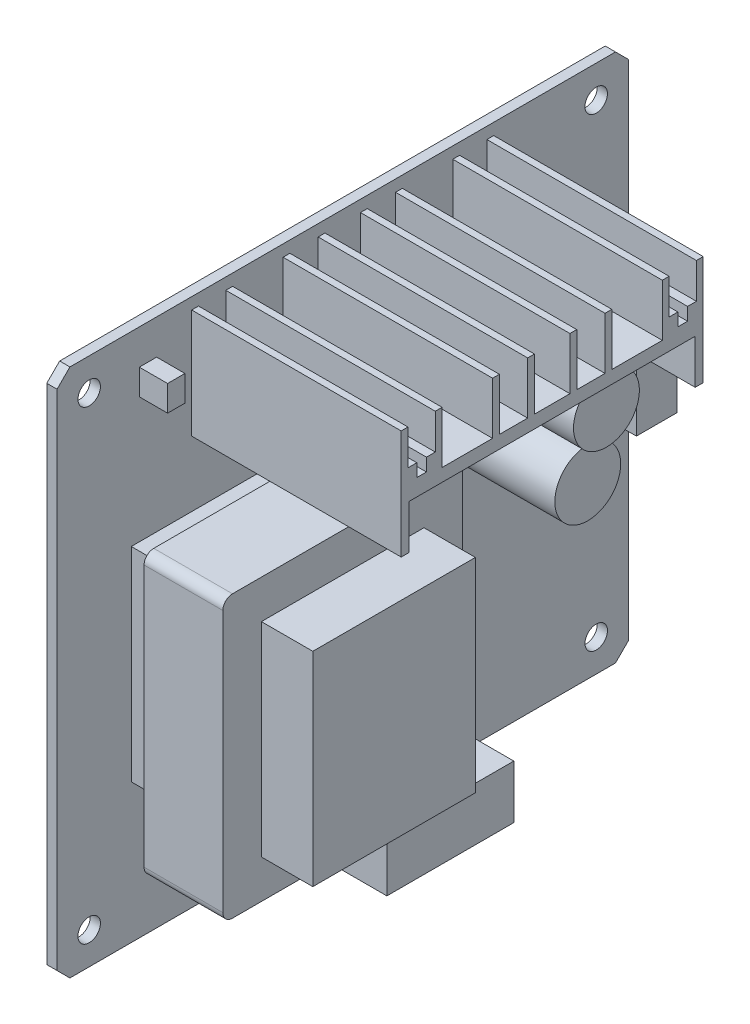
from build123d import *

# Parameters (mm, degrees)
BOSS_EXTRUDE1_START        = -1.6
BOSS_EXTRUDE1_OUTLINE_W    = 25.3
BOSS_EXTRUDE1_OUTLINE_H    = 31.72
BOSS_EXTRUDE1_DEPTH        = 29.85
BOSS_EXTRUDE1_START_2      = 8
BOSS_EXTRUDE1_2_OUTLINE_W  = 25.3
BOSS_EXTRUDE1_2_OUTLINE_H  = 31.72
BOSS_EXTRUDE1_2_OUTLINE_R  = 5.125
BOSS_EXTRUDE1_2_DEPTH      = 12.25
BOSS_EXTRUDE1_3_OUTLINE_R  = 1.75
BOSS_EXTRUDE1_3_OUTLINE_W  = 25.3
BOSS_EXTRUDE1_3_OUTLINE_H  = 31.72
BOSS_EXTRUDE1_3_DEPTH      = 1.6
BOSS_EXTRUDE1_4_OUTLINE_R  = 5.125
BOSS_EXTRUDE1_4_OUTLINE_W  = 19.75
BOSS_EXTRUDE1_4_OUTLINE_H  = 8.3
BOSS_EXTRUDE1_4_DEPTH      = 16.14
BOSS_EXTRUDE1_5_OUTLINE_W  = 6.35
BOSS_EXTRUDE1_5_OUTLINE_H  = 12.7
BOSS_EXTRUDE1_5_DEPTH      = 9
BOSS_EXTRUDE1_START_3      = 28.25
BOSS_EXTRUDE1_6_DEPTH      = 1.75
BOSS_EXTRUDE1_7_OUTLINE_W  = 7.2
BOSS_EXTRUDE1_7_OUTLINE_H  = 7.2
BOSS_EXTRUDE1_7_DEPTH      = 4.5
BOSS_EXTRUDE1_START_4      = 16.14
BOSS_EXTRUDE1_8_OUTLINE_W  = 19.75
BOSS_EXTRUDE1_8_OUTLINE_H  = 8.3
BOSS_EXTRUDE1_8_DEPTH      = 0.61
BOSS_EXTRUDE1_START_5      = -1.5
BOSS_EXTRUDE1_9_OUTLINE_W  = 5.1
BOSS_EXTRUDE1_9_OUTLINE_H  = 1.7
BOSS_EXTRUDE1_9_DEPTH      = 1.5
BOSS_EXTRUDE1_START_6      = 20.25
BOSS_EXTRUDE1_10_OUTLINE_R = 5.125
BOSS_EXTRUDE1_10_DEPTH     = 0.39
CUT_EXTRUDE1_START         = -1.5
SKETCH1_3_W                = 125.683572393
SKETCH1_3_H                = 110.20529993
SKETCH1_3_W_2              = 88.9
SKETCH1_3_H_2              = 82.35
SKETCH1_3_R                = 1.75
SKETCH1_3_W_3              = 5.1
SKETCH1_3_H_3              = 2
CUT_EXTRUDE1_DEPTH         = 1.5
CHAMFER1_SIZE              = 2
SKETCH2_W                  = 2.7
SKETCH2_H                  = 4
BOSS_EXTRUDE2_DEPTH        = 4.4
SKETCH3_R                  = 0.5
BOSS_EXTRUDE3_DEPTH        = 3
MOVE_FACE1_BY              = 2.6
MOVE_FACE2_BY              = 0.36


with BuildPart() as part:
    # Boss-Extrude1: read off the stored shape, not the designer's step
    # Boss-Extrude1 outline → Boss-Extrude1 (new body)
    with BuildSketch(Plane(origin=(-2.49, 0, 0), x_dir=(0, 0, -1), z_dir=(1, 0, 0)).offset(BOSS_EXTRUDE1_START)):
        with Locations((-263.102543264, -6.78)):
            Rectangle(BOSS_EXTRUDE1_OUTLINE_W, BOSS_EXTRUDE1_OUTLINE_H)
        Polygon((-240.09, 28.14), (-245.61, 28.14), (-245.61, 36.25), (-246.67, 36.25), (-246.67, 28.14), (-251.07, 28.14), (-251.07, 36.25), (-252.13, 36.25), (-252.13, 28.14), (-259.98, 28.14), (-259.98, 36.25), (-261.04, 36.25), (-261.04, 30.75), (-262.415, 30.75), (-262.415, 28.75), (-263.915, 28.75), (-263.915, 30.75), (-265.29, 30.75), (-265.29, 36.25), (-266.35, 36.25), (-266.35, 19.25), (-265.1, 19.25), (-265.1, 26.14), (-220.6, 26.14), (-220.6, 19.25), (-219.35, 19.25), (-219.35, 36.25), (-220.41, 36.25), (-220.41, 30.75), (-221.785, 30.75), (-221.785, 28.75), (-223.285, 28.75), (-223.285, 30.75), (-224.66, 30.75), (-224.66, 36.25), (-225.72, 36.25), (-225.72, 28.14), (-233.57, 28.14), (-233.57, 36.25), (-234.63, 36.25), (-234.63, 28.14), (-239.03, 28.14), (-239.03, 36.25), (-240.09, 36.25), align=None)
    extrude(amount=BOSS_EXTRUDE1_DEPTH)

    # Boss-Extrude1 2 outline → Boss-Extrude1 2 (add)
    # profile 1 of 2: a face of its own
    with BuildSketch(Plane(origin=(-2.49, 0, 0), x_dir=(0, 0, -1), z_dir=(1, 0, 0)).offset(BOSS_EXTRUDE1_START_2)):
        with BuildLine():
            ThreePointArc((-280.252543264, 15.08), (-281.313203436, 14.640660172), (-281.752543264, 13.58))
            Line((-281.752543264, 13.58), (-281.752543264, -27.14))
            ThreePointArc((-281.752543264, -27.14), (-281.313203436, -28.200660172), (-280.252543264, -28.64))
            Line((-280.252543264, -28.64), (-245.952543264, -28.64))
            ThreePointArc((-245.952543264, -28.64), (-244.891883092, -28.200660172), (-244.452543264, -27.14))
            Line((-244.452543264, -27.14), (-244.452543264, 13.58))
            ThreePointArc((-244.452543264, 13.58), (-244.891883092, 14.640660172), (-245.952543264, 15.08))
            Line((-245.952543264, 15.08), (-280.252543264, 15.08))
        make_face()
        with Locations((-263.102543264, -6.78)):
            Rectangle(BOSS_EXTRUDE1_2_OUTLINE_W, BOSS_EXTRUDE1_2_OUTLINE_H, mode=Mode.SUBTRACT)
    # profile 2 of 2: a face of its own
    with BuildSketch(Plane(origin=(-2.49, 0, 0), x_dir=(0, 0, -1), z_dir=(1, 0, 0)).offset(BOSS_EXTRUDE1_START_2)):
        with Locations((-222.447456736, 11.25)):
            Circle(BOSS_EXTRUDE1_2_OUTLINE_R)
    extrude(amount=BOSS_EXTRUDE1_2_DEPTH)

    # Boss-Extrude1 3 outline → Boss-Extrude1 3 (add)
    with BuildSketch(Plane(origin=(-2.49, 0, 0), x_dir=(0, 0, -1), z_dir=(1, 0, 0)).offset(BOSS_EXTRUDE1_START)):
        Polygon((-251.4, -42.3), (-251.4, -44.3), (-234.3, -44.3), (-234.3, -42.3), (-229.2, -42.3), (-229.2, -44.3), (-198.4, -44.3), (-198.4, 38.05), (-287.3, 38.05), (-287.3, -44.3), (-256.5, -44.3), (-256.5, -42.3), align=None)
        with Locations((-282.3, -39.3)):
            Circle(BOSS_EXTRUDE1_3_OUTLINE_R, mode=Mode.SUBTRACT)
        with Locations((-203.4, -39.3)):
            Circle(BOSS_EXTRUDE1_3_OUTLINE_R, mode=Mode.SUBTRACT)
        with Locations((-282.3, 33.05)):
            Circle(BOSS_EXTRUDE1_3_OUTLINE_R, mode=Mode.SUBTRACT)
        Polygon((-245.61, 36.25), (-245.61, 28.14), (-240.09, 28.14), (-240.09, 36.25), (-239.03, 36.25), (-239.03, 28.14), (-234.63, 28.14), (-234.63, 36.25), (-233.57, 36.25), (-233.57, 28.14), (-225.72, 28.14), (-225.72, 36.25), (-224.66, 36.25), (-224.66, 30.75), (-223.285, 30.75), (-223.285, 28.75), (-221.785, 28.75), (-221.785, 30.75), (-220.41, 30.75), (-220.41, 36.25), (-219.35, 36.25), (-219.35, 19.25), (-220.6, 19.25), (-220.6, 26.14), (-265.1, 26.14), (-265.1, 19.25), (-266.35, 19.25), (-266.35, 36.25), (-265.29, 36.25), (-265.29, 30.75), (-263.915, 30.75), (-263.915, 28.75), (-262.415, 28.75), (-262.415, 30.75), (-261.04, 30.75), (-261.04, 36.25), (-259.98, 36.25), (-259.98, 28.14), (-252.13, 28.14), (-252.13, 36.25), (-251.07, 36.25), (-251.07, 28.14), (-246.67, 28.14), (-246.67, 36.25), align=None, mode=Mode.SUBTRACT)
        with Locations((-203.4, 33.05)):
            Circle(BOSS_EXTRUDE1_3_OUTLINE_R, mode=Mode.SUBTRACT)
        with Locations((-263.102543264, -6.78)):
            Rectangle(BOSS_EXTRUDE1_3_OUTLINE_W, BOSS_EXTRUDE1_3_OUTLINE_H, mode=Mode.SUBTRACT)
    extrude(amount=BOSS_EXTRUDE1_3_DEPTH)

    # Boss-Extrude1 4 outline → Boss-Extrude1 4 (add)
    with BuildSketch(Plane(origin=(-2.49, 0, 0), x_dir=(0, 0, -1), z_dir=(1, 0, 0))):
        with Locations((-221.216821393, -1.35)):
            Circle(BOSS_EXTRUDE1_4_OUTLINE_R)
        with Locations((-242.85, -37)):
            Rectangle(BOSS_EXTRUDE1_4_OUTLINE_W, BOSS_EXTRUDE1_4_OUTLINE_H)
        with Locations((-222.447456736, 11.25)):
            Circle(BOSS_EXTRUDE1_4_OUTLINE_R)
    extrude(amount=BOSS_EXTRUDE1_4_DEPTH)

    # Boss-Extrude1 5 outline → Boss-Extrude1 5 (add)
    with BuildSketch(Plane(origin=(-2.49, 0, 0), x_dir=(0, 0, -1), z_dir=(1, 0, 0))):
        with Locations((-202.972456736, 0)):
            Rectangle(BOSS_EXTRUDE1_5_OUTLINE_W, BOSS_EXTRUDE1_5_OUTLINE_H)
    extrude(amount=BOSS_EXTRUDE1_5_DEPTH)

    # Boss-Extrude1 6 outline → Boss-Extrude1 6 (add)
    with BuildSketch(Plane(origin=(-2.49, 0, 0), x_dir=(0, 0, -1), z_dir=(1, 0, 0)).offset(BOSS_EXTRUDE1_START_3)):
        Polygon((-240.09, 28.14), (-245.61, 28.14), (-245.61, 36.25), (-246.67, 36.25), (-246.67, 28.14), (-251.07, 28.14), (-251.07, 36.25), (-252.13, 36.25), (-252.13, 28.14), (-259.98, 28.14), (-259.98, 36.25), (-261.04, 36.25), (-261.04, 30.75), (-262.415, 30.75), (-262.415, 28.75), (-263.915, 28.75), (-263.915, 30.75), (-265.29, 30.75), (-265.29, 36.25), (-266.35, 36.25), (-266.35, 19.25), (-265.1, 19.25), (-265.1, 26.14), (-220.6, 26.14), (-220.6, 19.25), (-219.35, 19.25), (-219.35, 36.25), (-220.41, 36.25), (-220.41, 30.75), (-221.785, 30.75), (-221.785, 28.75), (-223.285, 28.75), (-223.285, 30.75), (-224.66, 30.75), (-224.66, 36.25), (-225.72, 36.25), (-225.72, 28.14), (-233.57, 28.14), (-233.57, 36.25), (-234.63, 36.25), (-234.63, 28.14), (-239.03, 28.14), (-239.03, 36.25), (-240.09, 36.25), align=None)
    extrude(amount=BOSS_EXTRUDE1_6_DEPTH)

    # Boss-Extrude1 7 outline → Boss-Extrude1 7 (add)
    with BuildSketch(Plane(origin=(-2.49, 0, 0), x_dir=(0, 0, -1), z_dir=(1, 0, 0))):
        with Locations((-232.947456736, -6)):
            Rectangle(BOSS_EXTRUDE1_7_OUTLINE_W, BOSS_EXTRUDE1_7_OUTLINE_H)
    extrude(amount=BOSS_EXTRUDE1_7_DEPTH)

    # Boss-Extrude1 8 outline → Boss-Extrude1 8 (add)
    with BuildSketch(Plane(origin=(-2.49, 0, 0), x_dir=(0, 0, -1), z_dir=(1, 0, 0)).offset(BOSS_EXTRUDE1_START_4)):
        with Locations((-242.85, -37)):
            Rectangle(BOSS_EXTRUDE1_8_OUTLINE_W, BOSS_EXTRUDE1_8_OUTLINE_H)
    extrude(amount=BOSS_EXTRUDE1_8_DEPTH)

    # Boss-Extrude1 9 outline → Boss-Extrude1 9 (add)
    with BuildSketch(Plane(origin=(-2.49, 0, 0), x_dir=(0, 0, -1), z_dir=(1, 0, 0)).offset(BOSS_EXTRUDE1_START_5)):
        with Locations((-253.95, -43.15)):
            Rectangle(BOSS_EXTRUDE1_9_OUTLINE_W, BOSS_EXTRUDE1_9_OUTLINE_H)
        with Locations((-231.75, -43.15)):
            Rectangle(BOSS_EXTRUDE1_9_OUTLINE_W, BOSS_EXTRUDE1_9_OUTLINE_H)
        Polygon((-287.752543264, -23.847456736), (-287.3, -24.3), (-287.3, 24.580582618), (-287.752543264, 24.580582618), align=None)
        Polygon((-198.4, 26.105086528), (-198.4, -24.3), (-197.947456736, -23.847456736), (-197.947456736, 25.652543264), align=None)
        with BuildLine():
            Line((-281.502543264, 33.330582618), (-281.502543264, 31.492257161))
            ThreePointArc((-281.502543264, 31.492257161), (-280.609414894, 32.597869487), (-280.831414071, 34.00171181))
            Line((-280.831414071, 34.00171181), (-281.502543264, 33.330582618))
        make_face()
        with BuildLine():
            Line((-203.60722612, 31.312312647), (-205.137687353, 32.84277388))
            ThreePointArc((-205.137687353, 32.84277388), (-204.637436867, 31.812563133), (-203.60722612, 31.312312647))
        make_face()
    extrude(amount=BOSS_EXTRUDE1_9_DEPTH)

    # Boss-Extrude1 10 outline → Boss-Extrude1 10 (add)
    with BuildSketch(Plane(origin=(-2.49, 0, 0), x_dir=(0, 0, -1), z_dir=(1, 0, 0)).offset(BOSS_EXTRUDE1_START_6)):
        with Locations((-222.447456736, 11.25)):
            Circle(BOSS_EXTRUDE1_10_OUTLINE_R)
    extrude(amount=BOSS_EXTRUDE1_10_DEPTH)

    # Sketch1<3> → Cut-Extrude1 (cut)
    # profile 1 of 7: a face of its own
    with BuildSketch(Plane(origin=(-2.49, 0, 0), x_dir=(0, 0, -1), z_dir=(1, 0, 0)).offset(CUT_EXTRUDE1_START)):
        with Locations((-237.633848224, 0.203353058)):
            Rectangle(SKETCH1_3_W, SKETCH1_3_H)
        with Locations((-242.85, -3.125)):
            Rectangle(SKETCH1_3_W_2, SKETCH1_3_H_2, mode=Mode.SUBTRACT)
    # profile 2 of 7: a face of its own
    with BuildSketch(Plane(origin=(-2.49, 0, 0), x_dir=(0, 0, -1), z_dir=(1, 0, 0)).offset(CUT_EXTRUDE1_START)):
        with Locations((-282.3, 33.05)):
            Circle(SKETCH1_3_R)
    # profile 3 of 7: a face of its own
    with BuildSketch(Plane(origin=(-2.49, 0, 0), x_dir=(0, 0, -1), z_dir=(1, 0, 0)).offset(CUT_EXTRUDE1_START)):
        with Locations((-203.4, 33.05)):
            Circle(SKETCH1_3_R)
    # profile 4 of 7: a face of its own
    with BuildSketch(Plane(origin=(-2.49, 0, 0), x_dir=(0, 0, -1), z_dir=(1, 0, 0)).offset(CUT_EXTRUDE1_START)):
        with Locations((-203.4, -39.3)):
            Circle(SKETCH1_3_R)
    # profile 5 of 7: a face of its own
    with BuildSketch(Plane(origin=(-2.49, 0, 0), x_dir=(0, 0, -1), z_dir=(1, 0, 0)).offset(CUT_EXTRUDE1_START)):
        with Locations((-282.3, -39.3)):
            Circle(SKETCH1_3_R)
    # profile 6 of 7: a face of its own
    with BuildSketch(Plane(origin=(-2.49, 0, 0), x_dir=(0, 0, -1), z_dir=(1, 0, 0)).offset(CUT_EXTRUDE1_START)):
        with Locations((-253.95, -43.3)):
            Rectangle(SKETCH1_3_W_3, SKETCH1_3_H_3)
    # profile 7 of 7: a face of its own
    with BuildSketch(Plane(origin=(-2.49, 0, 0), x_dir=(0, 0, -1), z_dir=(1, 0, 0)).offset(CUT_EXTRUDE1_START)):
        with Locations((-231.75, -43.3)):
            Rectangle(SKETCH1_3_W_3, SKETCH1_3_H_3)
    extrude(amount=CUT_EXTRUDE1_DEPTH, mode=Mode.SUBTRACT)

    # Chamfer1
    chamfer1_edges = [part.edges().sort_by_distance(p)[0] for p in [
        (-3.29, -44.3, 287.3),
        (-3.29, 38.05, 198.4),
        (-3.29, 38.05, 287.3),
        (-3.29, -44.3, 198.4),
    ]]
    chamfer(chamfer1_edges, length=CHAMFER1_SIZE)

    # Sketch2 → Boss-Extrude2 (add)
    with BuildSketch(Plane(origin=(-2.49, 0, 0), x_dir=(0, 0, -1), z_dir=(1, 0, 0))):
        with Locations((-273.15, 30.62)):
            Rectangle(SKETCH2_W, SKETCH2_H)
    extrude(amount=BOSS_EXTRUDE2_DEPTH)

    # Sketch3 → Boss-Extrude3 (add)
    with BuildSketch(Plane.ZY.offset(4.09)):
        with Locations(Location((234.85, -37.3, 0), (0, 0, 180))):
            Circle(SKETCH3_R)
        with Locations(Location((250.85, -37.3, 0), (0, 0, 180))):
            Circle(SKETCH3_R)
    extrude(amount=BOSS_EXTRUDE3_DEPTH)

    # Move Face1: a face moved outward by 2.6
    extrude(part.faces().sort_by_distance((27.51, 27.75, 242.85))[0], amount=MOVE_FACE1_BY, dir=(1, 0, 0))

    # Move Face2: a face moved outward by 0.36
    extrude(part.faces().sort_by_distance((13.65, -1.35, 221.216821393))[0], amount=MOVE_FACE2_BY, dir=(1, 0, 0))


solid = part.part
